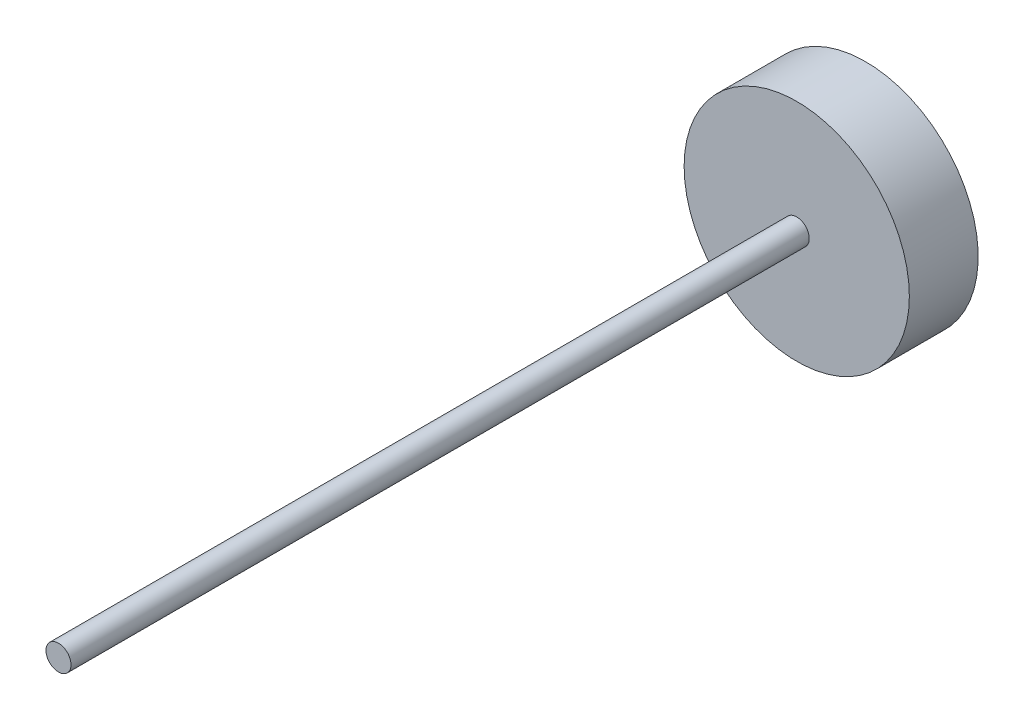
from build123d import *

# Parameters (mm, degrees)
SKETCH1_R                = 88
BOSS_EXTRUDE3_DEPTH      = 25
SKETCH4_W                = 10.4719
SKETCH4_H                = 13.351164338
BOSS_EXTRUDE4_DEPTH      = 25
FILLET2_R                = 4
CIRPATTERN1_COUNT        = 30
FILLET2_OF_CIRPATTERN1_R = 4
SKETCH6_R                = 10
BOSS_EXTRUDE5_DEPTH      = 60
BOSS_EXTRUDE6_START      = 10
SKETCH7_R                = 10
BOSS_EXTRUDE6_DEPTH      = 10
SKETCH8_R                = 10
BOSS_EXTRUDE7_DEPTH      = 10
SKETCH9_R                = 10
BOSS_EXTRUDE8_DEPTH      = 25
SKETCH10_R               = 10
BOSS_EXTRUDE9_DEPTH      = 42.5
SKETCH12_R               = 12.5
CUT_EXTRUDE1_DEPTH       = 12
CUT_EXTRUDE2_START       = -55.5
SKETCH13_R               = 10
CUT_EXTRUDE2_DEPTH       = 55.5
SKETCH14_R               = 10
BOSS_EXTRUDE10_DEPTH     = 440
SKETCH15_R               = 105
BOSS_EXTRUDE12_DEPTH     = 25
BOSS_EXTRUDE13_START     = 30
SKETCH16_R               = 105
BOSS_EXTRUDE13_DEPTH     = 30
SKETCH17_R               = 10
BOSS_EXTRUDE14_DEPTH     = 50
SKETCH18_R               = 10
BOSS_EXTRUDE15_DEPTH     = 30
SKETCH19_R               = 105
SKETCH19_R_2             = 90
CUT_EXTRUDE3_DEPTH       = 100
SHELL3_START             = -30
SHELL3_OUTLINE_R         = 80
SHELL3_DEPTH             = 45


# Read off the part's stored shape, not the designer's step: Shell3
with BuildPart() as part:
    # Sketch1 → Boss-Extrude3 (new body)
    with BuildSketch(Plane.XY):
        Circle(SKETCH1_R)
    extrude(amount=BOSS_EXTRUDE3_DEPTH)

    # Sketch4 → Boss-Extrude4 (add)
    with BuildSketch(Plane.XY.offset(25)):
        with Locations((0, 93.324417831)):
            Rectangle(SKETCH4_W, SKETCH4_H)
    boss_extrude4 = extrude(amount=-BOSS_EXTRUDE4_DEPTH)

    # Fillet2
    fillet2_edges = [part.edges().sort_by_distance(p)[0] for p in [
        (5.23595, 100, 12.5),
        (0, 100, 0),
        (-5.23595, 100, 12.5),
        (0, 100, 25),
    ]]
    fillet(fillet2_edges, radius=FILLET2_R)

    # CirPattern1: Boss-Extrude4 ×30 about axis
    cirpattern1_axis = Axis((0, 0.317667884, 0), (0, 0, 1))
    for i in range(1, CIRPATTERN1_COUNT):
        add(boss_extrude4.rotate(cirpattern1_axis, i * 360 / CIRPATTERN1_COUNT))

    # Fillet2 of CirPattern1
    fillet2_of_cirpattern1_edges = [part.edges().sort_by_distance(p)[0] for p in [
        (-15.603590285, 98.910317096, 12.5),
        (-20.725122215, 97.821701879, 0),
        (-25.846654145, 96.733086661, 12.5),
        (-20.725122215, 97.821701879, 25),
        (-35.7611788, 93.511662322, 12.5),
        (-40.544457139, 91.382009596, 0),
        (-45.327735478, 89.252356869, 12.5),
        (-40.544457139, 91.382009596, 25),
        (-54.3558322, 84.039982796, 12.5),
        (-58.591804732, 80.962368605, 0),
        (-62.827777264, 77.884754413, 12.5),
        (-58.591804732, 80.962368605, 25),
        (-70.574874905, 70.909236365, 12.5),
        (-74.078409304, 67.018167216, 0),
        (-77.581943702, 63.127098067, 12.5),
        (-74.078409304, 67.018167216, 25),
        (-83.709456921, 54.693299655, 12.5),
        (-86.327431921, 50.158833942, 0),
        (-88.945406921, 45.624368229, 12.5),
        (-86.327431921, 50.158833942, 25),
        (-93.185533987, 36.100886913, 12.5),
        (-94.803531519, 31.121202547, 0),
        (-96.42152905, 26.14151818, 12.5),
        (-94.803531519, 31.121202547, 25),
        (-98.588956064, 15.944575793, 12.5),
        (-99.136261871, 10.737308875, 0),
        (-99.683567678, 5.530041957, 12.5),
        (-99.136261871, 10.737308875, 25),
        (-99.683567678, -4.894706189, 12.5),
        (-99.136261871, -10.101973107, 0),
        (-98.588956064, -15.309240025, 12.5),
        (-99.136261871, -10.101973107, 25),
        (-96.42152905, -25.506182413, 12.5),
        (-94.803531519, -30.485866779, 0),
        (-93.185533987, -35.465551145, 12.5),
        (-94.803531519, -30.485866779, 25),
        (-88.945406921, -44.989032461, 12.5),
        (-86.327431921, -49.523498174, 0),
        (-83.709456921, -54.057963887, 12.5),
        (-86.327431921, -49.523498174, 25),
        (-77.581943702, -62.491762299, 12.5),
        (-74.078409304, -66.382831448, 0),
        (-70.574874905, -70.273900597, 12.5),
        (-74.078409304, -66.382831448, 25),
        (-62.827777264, -77.249418645, 12.5),
        (-58.591804732, -80.327032837, 0),
        (-54.3558322, -83.404647029, 12.5),
        (-58.591804732, -80.327032837, 25),
        (-45.327735478, -88.617021102, 12.5),
        (-40.544457139, -90.746673828, 0),
        (-35.7611788, -92.876326554, 12.5),
        (-40.544457139, -90.746673828, 25),
        (-25.846654145, -96.097750894, 12.5),
        (-20.725122215, -97.186366111, 0),
        (-15.603590285, -98.274981329, 12.5),
        (-20.725122215, -97.186366111, 25),
        (-5.23595, -99.364664232, 12.5),
        (0, -99.364664232, 0),
        (5.23595, -99.364664232, 12.5),
        (0, -99.364664232, 25),
        (15.603590285, -98.274981329, 12.5),
        (20.725122215, -97.186366111, 0),
        (25.846654145, -96.097750894, 12.5),
        (20.725122215, -97.186366111, 25),
        (35.7611788, -92.876326554, 12.5),
        (40.544457139, -90.746673828, 0),
        (45.327735478, -88.617021102, 12.5),
        (40.544457139, -90.746673828, 25),
        (54.3558322, -83.404647029, 12.5),
        (58.591804732, -80.327032837, 0),
        (62.827777264, -77.249418645, 12.5),
        (58.591804732, -80.327032837, 25),
        (70.574874905, -70.273900597, 12.5),
        (74.078409304, -66.382831448, 0),
        (77.581943702, -62.491762299, 12.5),
        (74.078409304, -66.382831448, 25),
        (83.709456921, -54.057963887, 12.5),
        (86.327431921, -49.523498174, 0),
        (88.945406921, -44.989032461, 12.5),
        (86.327431921, -49.523498174, 25),
        (93.185533987, -35.465551145, 12.5),
        (94.803531519, -30.485866779, 0),
        (96.42152905, -25.506182413, 12.5),
        (94.803531519, -30.485866779, 25),
        (98.588956064, -15.309240025, 12.5),
        (99.136261871, -10.101973107, 0),
        (99.683567678, -4.894706189, 12.5),
        (99.136261871, -10.101973107, 25),
        (99.683567678, 5.530041957, 12.5),
        (99.136261871, 10.737308875, 0),
        (98.588956064, 15.944575793, 12.5),
        (99.136261871, 10.737308875, 25),
        (96.42152905, 26.14151818, 12.5),
        (94.803531519, 31.121202547, 0),
        (93.185533987, 36.100886913, 12.5),
        (94.803531519, 31.121202547, 25),
        (88.945406921, 45.624368229, 12.5),
        (86.327431921, 50.158833942, 0),
        (83.709456921, 54.693299655, 12.5),
        (86.327431921, 50.158833942, 25),
        (77.581943702, 63.127098067, 12.5),
        (74.078409304, 67.018167216, 0),
        (70.574874905, 70.909236365, 12.5),
        (74.078409304, 67.018167216, 25),
        (62.827777264, 77.884754413, 12.5),
        (58.591804732, 80.962368605, 0),
        (54.3558322, 84.039982796, 12.5),
        (58.591804732, 80.962368605, 25),
        (45.327735478, 89.252356869, 12.5),
        (40.544457139, 91.382009596, 0),
        (35.7611788, 93.511662322, 12.5),
        (40.544457139, 91.382009596, 25),
        (25.846654145, 96.733086661, 12.5),
        (20.725122215, 97.821701879, 0),
        (15.603590285, 98.910317096, 12.5),
        (20.725122215, 97.821701879, 25),
    ]]
    fillet(fillet2_of_cirpattern1_edges, radius=FILLET2_OF_CIRPATTERN1_R)

    # Sketch6 → Boss-Extrude5 (add)
    with BuildSketch(Plane.XY.offset(25)):
        Circle(SKETCH6_R)
    extrude(amount=BOSS_EXTRUDE5_DEPTH)

    # Sketch7 → Boss-Extrude6 (add)
    with BuildSketch(Plane(origin=(0, 0, 0), x_dir=(-1, 0, 0), z_dir=(0, 0, -1)).offset(BOSS_EXTRUDE6_START)):
        with Locations(Location((0, 0, 0), (0, 0, 180))):
            Circle(SKETCH7_R)
    extrude(amount=-BOSS_EXTRUDE6_DEPTH)

    # Sketch8 → Boss-Extrude7 (add)
    with BuildSketch(Plane.XY.offset(85)):
        Circle(SKETCH8_R)
    extrude(amount=BOSS_EXTRUDE7_DEPTH)

    # Sketch9 → Boss-Extrude8 (add)
    with BuildSketch(Plane.XY.offset(95)):
        Circle(SKETCH9_R)
    extrude(amount=BOSS_EXTRUDE8_DEPTH)

    # Sketch10 → Boss-Extrude9 (add)
    with BuildSketch(Plane.XY.offset(120)):
        Circle(SKETCH10_R)
    extrude(amount=BOSS_EXTRUDE9_DEPTH)

    # Sketch12 → Cut-Extrude1 (cut)
    with BuildSketch(Plane.XY.offset(162.5)):
        Circle(SKETCH12_R)
    extrude(amount=-CUT_EXTRUDE1_DEPTH, mode=Mode.SUBTRACT)

    # Sketch13 → Cut-Extrude2 (cut)
    with BuildSketch(Plane.XY.offset(150.5).offset(CUT_EXTRUDE2_START)):
        Circle(SKETCH13_R)
    extrude(amount=CUT_EXTRUDE2_DEPTH, mode=Mode.SUBTRACT)

    # Sketch14 → Boss-Extrude10 (add)
    with BuildSketch(Plane.XY.offset(95)):
        Circle(SKETCH14_R)
    extrude(amount=BOSS_EXTRUDE10_DEPTH)

    # Sketch15 → Boss-Extrude12 (add)
    with BuildSketch(Plane(origin=(0, 0, 0), x_dir=(-1, 0, 0), z_dir=(0, 0, -1))):
        Circle(SKETCH15_R)
    extrude(amount=-BOSS_EXTRUDE12_DEPTH)

    # Sketch16 → Boss-Extrude13 (add)
    with BuildSketch(Plane(origin=(0, 0, 0), x_dir=(-1, 0, 0), z_dir=(0, 0, -1)).offset(BOSS_EXTRUDE13_START)):
        Circle(SKETCH16_R)
    extrude(amount=-BOSS_EXTRUDE13_DEPTH)

    # Sketch17 → Boss-Extrude14 (add)
    with BuildSketch(Plane.XY.offset(535)):
        Circle(SKETCH17_R)
    extrude(amount=BOSS_EXTRUDE14_DEPTH)

    # Sketch18 → Boss-Extrude15 (add)
    with BuildSketch(Plane.XY.offset(585)):
        Circle(SKETCH18_R)
    extrude(amount=BOSS_EXTRUDE15_DEPTH)

    # Sketch19 → Cut-Extrude3 (cut)
    with BuildSketch(Plane(origin=(0, 0, -30), x_dir=(-1, 0, 0), z_dir=(0, 0, -1))):
        Circle(SKETCH19_R)
        Circle(SKETCH19_R_2, mode=Mode.SUBTRACT)
    extrude(amount=-CUT_EXTRUDE3_DEPTH, mode=Mode.SUBTRACT)

    # Shell3 outline → Shell3 (cut)
    with BuildSketch(Plane.XY.offset(SHELL3_START)):
        Circle(SHELL3_OUTLINE_R)
    extrude(amount=SHELL3_DEPTH, mode=Mode.SUBTRACT)


solid = part.part
